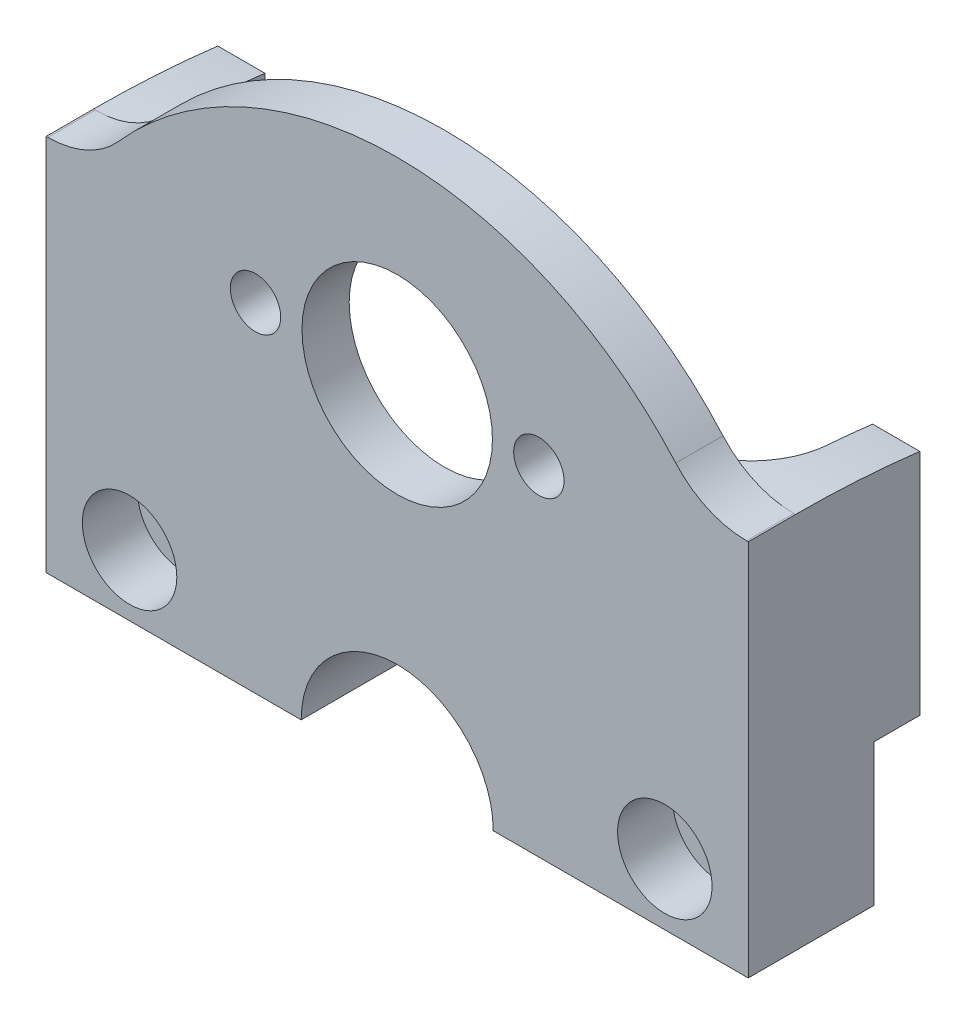
from build123d import *

# Parameters (mm, degrees)
SKETCH_2_R          = 6.05
SKETCH_2_R_2        = 1.6
EXTRUDE_1_DEPTH     = 3
SKETCH_2_3_R        = 1.6
EXTRUDE_2_DEPTH     = 8
SKETCH_3_R          = 1.65
EXTRUDE_4_DEPTH     = 3
SKETCH_5_R          = 3
CUT_EXTRUDE_1_DEPTH = 3.5
SKETCH_6_W          = 55.305281636
SKETCH_6_H          = 51.082077229
CUT_EXTRUDE_2_DEPTH = 82.174934555
FILLET_10_R         = 6
FILLET_11_R         = 5


with BuildPart() as part:
    # ｽｹｯﾁ2 → ﾎﾞｽ - 押し出し1 (new body)
    with BuildSketch(Plane.XY):
        with BuildLine():
            Line((-22.3, 23.9), (22.3, 23.9))
            Line((22.3, 23.9), (22.3, 38.9))
            Line((22.3, 38.9), (19.3, 38.9))
            ThreePointArc((19.3, 38.9), (0, 48.9), (-19.3, 38.9))
            Line((-19.3, 38.9), (-22.3, 38.9))
            Line((-22.3, 38.9), (-22.3, 23.9))
        make_face()
        with Locations((0, 36.4)):
            Circle(SKETCH_2_R, mode=Mode.SUBTRACT)
        with Locations((-9, 36.4)):
            Circle(SKETCH_2_R_2, mode=Mode.SUBTRACT)
        with Locations((9, 36.4)):
            Circle(SKETCH_2_R_2, mode=Mode.SUBTRACT)
    extrude(amount=-EXTRUDE_1_DEPTH)

    # ｽｹｯﾁ2<3> → ﾎﾞｽ - 押し出し2 (add)
    with BuildSketch(Plane.XY):
        with BuildLine():
            Line((22.3, 23.9), (-22.3, 23.9))
            Line((-22.3, 23.9), (-22.3, 14.9))
            Line((-22.3, 14.9), (-6.1, 14.9))
            ThreePointArc((-6.1, 14.9), (0, 21), (6.1, 14.9))
            Line((6.1, 14.9), (22.3, 14.9))
            Line((22.3, 14.9), (22.3, 23.9))
        make_face()
        with Locations((-17, 18.8)):
            Circle(SKETCH_2_3_R, mode=Mode.SUBTRACT)
        with Locations((17, 18.8)):
            Circle(SKETCH_2_3_R, mode=Mode.SUBTRACT)
    extrude(amount=-EXTRUDE_2_DEPTH)

    # ｽｹｯﾁ3 → ﾎﾞｽ - 押し出し4 (add)
    with BuildSketch(Plane.ZY.offset(22.3)):
        with BuildLine():
            Line((-8, 23.9), (-10.9, 23.9))
            Line((-10.9, 23.9), (-10.9, 16.120888862))
            Line((-10.9, 16.120888862), (-43, 16.120888862))
            ThreePointArc((-43, 16.120888862), (-46.752084661, 18.734576957), (-45.600779817, 23.159958513))
            ThreePointArc((-45.600779817, 23.159958513), (-25.707792424, 34.839146133), (-3, 38.9))
            Line((-3, 38.9), (-3, 23.9))
            Line((-3, 23.9), (-8, 23.9))
        make_face()
        with Locations(Location((-43, 20.120888862, 0), (0, 0, 270))):
            Circle(SKETCH_3_R, mode=Mode.SUBTRACT)
    extrude_4 = extrude(amount=-EXTRUDE_4_DEPTH)

    # ﾐﾗｰ11: ﾎﾞｽ - 押し出し4 across plane
    add(extrude_4.mirror(Plane(origin=(0, 0, 0), x_dir=(0, 0, 1), z_dir=(1, 0, 0))))

    # ｽｹｯﾁ5 → ｶｯﾄ - 押し出し1 (cut)
    with BuildSketch(Plane.XY):
        with Locations((-17, 18.8)):
            Circle(SKETCH_5_R)
        with Locations((17, 18.8)):
            Circle(SKETCH_5_R)
    extrude(amount=-CUT_EXTRUDE_1_DEPTH, mode=Mode.SUBTRACT)

    # ｽｹｯﾁ6 → ｶｯﾄ - 押し出し2 (cut, through all)
    with BuildSketch(Plane.ZY.offset(22.3)):
        with Locations((-38.552640818, 41.661927477)):
            Rectangle(SKETCH_6_W, SKETCH_6_H)
    extrude(amount=-CUT_EXTRUDE_2_DEPTH, mode=Mode.SUBTRACT)

    # ﾌｨﾚｯﾄ10
    # the kernel refuses this fillet: 6 mm, written as the material it adds along each edge
    with BuildSketch(Plane(origin=(19.3, 38.9, 0), x_dir=(-0.6205037663908469, 0.7842034658778125, 0), z_dir=(0, 0, -1))) as fillet_10_piece_1:
        with BuildLine():
            CenterArc((2.9106521, 5.991029767), FILLET_10_R, 218.352931503, 48.513653053)
            Line((-1.794568695, 2.268007169), (0, 0))
            ThreePointArc((0, 0), (1.29134257, 0.035319543), (2.582685141, 0))
        make_face()
    extrude(amount=3)
    with BuildSketch(Plane(origin=(-19.3, 38.9, 0), x_dir=(-1, 0, 0), z_dir=(0, 0, -1))) as fillet_10_piece_2:
        with BuildLine():
            CenterArc((2.892115717, 6), FILLET_10_R, 221.486346947, 48.513653053)
            ThreePointArc((-1.602565857, 2.025350639), (-0.77358522, 1.034591229), (0, 0))
            Line((0, 0), (2.892115717, 0))
        make_face()
    extrude(amount=3)

    # ﾌｨﾚｯﾄ11
    fillet_11_edges = [part.edges().sort_by_distance(p)[0] for p in [
        (19.3, 31.4, -3),
        (-19.3, 31.4, -3),
    ]]
    fillet(fillet_11_edges, radius=FILLET_11_R)


solid = part.part
